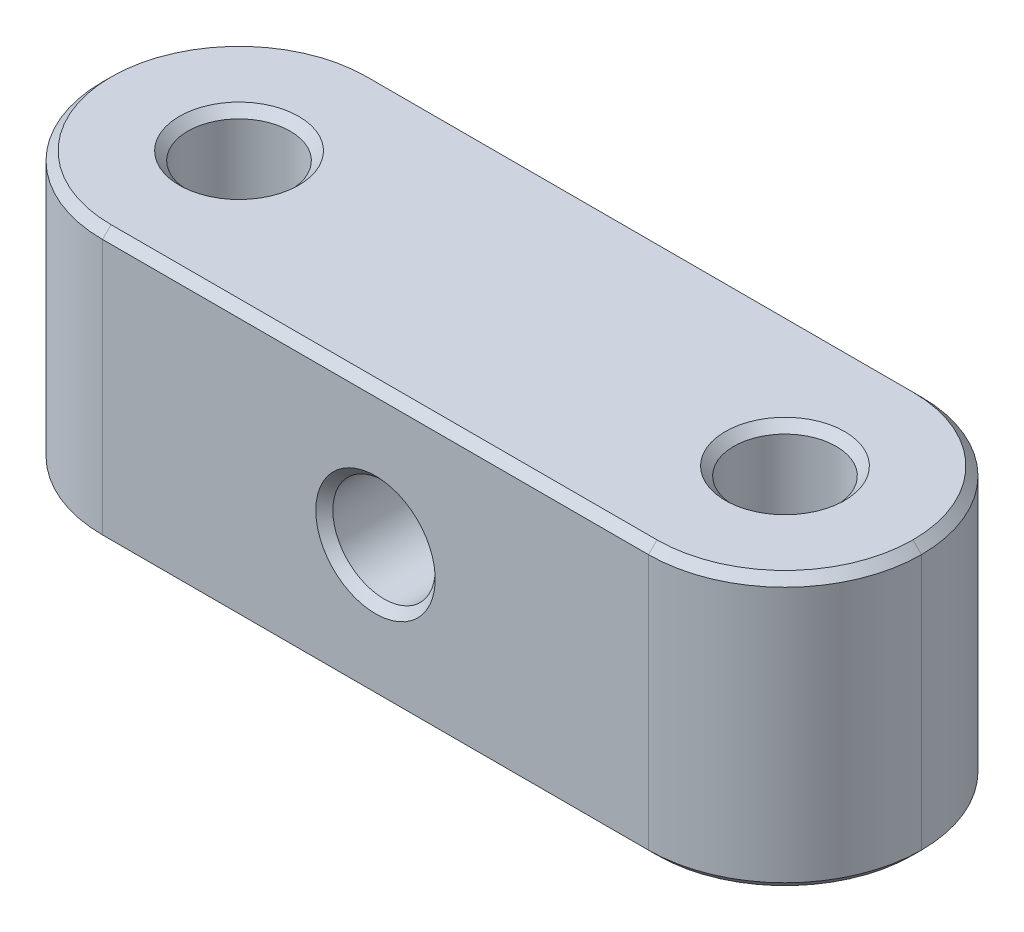
from build123d import *

# Parameters (mm, degrees)
SKETCH1_W               = 38.1
SKETCH1_H               = 12.7
SKETCH1_R               = 2.38125
BOSS_EXTRUDE1_DEPTH     = 12.7
CUT_EXTRUDE1_DEPTH      = 43.121134838
CUT_EXTRUDE1_DEPTH_BACK = 43.121134838
SKETCH2_R               = 2.38125
FILLET2_R               = 6.35
CHAMFER3_SIZE           = 0.396875


with BuildPart() as part:
    # Sketch1 → Boss-Extrude1 (new body)
    with BuildSketch(Plane(origin=(0, 0, 0), x_dir=(1, 0, 0), z_dir=(0, 1, 0))):
        with Locations((19.05, 6.35)):
            Rectangle(SKETCH1_W, SKETCH1_H)
        with Locations(Location((6.35, 6.35, 0), (0, 0, 270))):
            Circle(SKETCH1_R, mode=Mode.SUBTRACT)
        with Locations(Location((31.75, 6.35, 0), (0, 0, 270))):
            Circle(SKETCH1_R, mode=Mode.SUBTRACT)
    extrude(amount=BOSS_EXTRUDE1_DEPTH)

    # Sketch2 → Cut-Extrude1 (cut, two sides: drawn at the far end of the back side and taken through both)
    with BuildSketch(Plane.XY.offset(-CUT_EXTRUDE1_DEPTH_BACK)):
        with Locations((19.05, 6.35)):
            Circle(SKETCH2_R)
    extrude(amount=CUT_EXTRUDE1_DEPTH + CUT_EXTRUDE1_DEPTH_BACK, mode=Mode.SUBTRACT)

    # Fillet2
    fillet2_edges = [part.edges().sort_by_distance(p)[0] for p in [
        (0, 6.35, -12.7),
        (0, 6.35, 0),
        (38.1, 6.35, -12.7),
        (38.1, 6.35, 0),
    ]]
    fillet(fillet2_edges, radius=FILLET2_R - 0.0001)  # a hair under: the kernel refuses the full size

    # Chamfer3
    chamfer3_edges = [part.edges().sort_by_distance(p)[0] for p in [
        (6.35, 0, -8.73125),
        (6.35, 12.7, -8.73125),
        (31.75, 0, -8.73125),
        (31.75, 12.7, -8.73125),
        (16.66875, 6.35, -12.7),
        (16.66875, 6.35, 0),
        (19.05, 0, -12.7),
        (19.05, 0, 0),
        (36.24015735, 0, -1.85984265),
        (36.24015735, 0, -10.84015735),
        (1.85984265, 0, -1.85984265),
        (1.85984265, 0, -10.84015735),
        (19.05, 12.7, -12.7),
        (19.05, 12.7, 0),
        (36.24015735, 12.7, -1.85984265),
        (36.24015735, 12.7, -10.84015735),
        (1.85984265, 12.7, -1.85984265),
        (1.85984265, 12.7, -10.84015735),
    ]]
    chamfer(chamfer3_edges, length=CHAMFER3_SIZE)


solid = part.part
